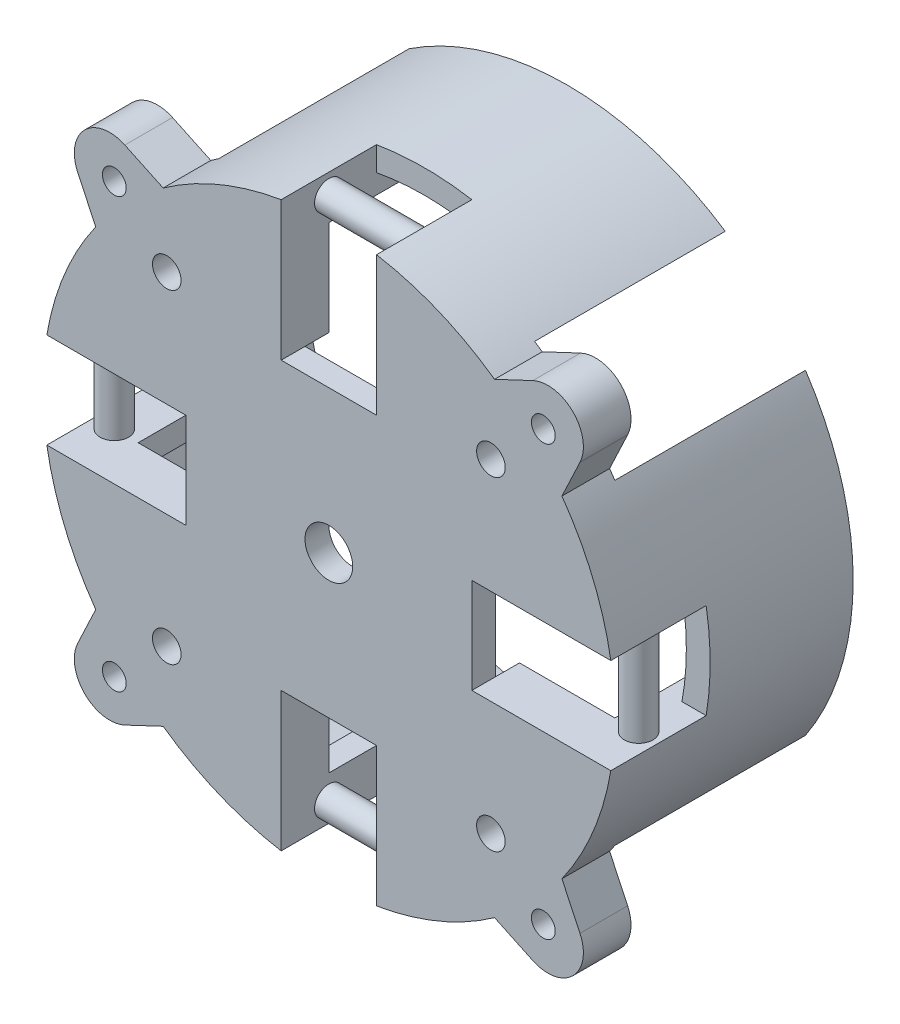
from build123d import *

# Parameters (mm, degrees)
SKETCH_1_R          = 60
EXTRUDE_1_DEPTH     = 50
SKETCH_2_R          = 3
CUT_EXTRUDE_1_DEPTH = 10
SHELL_START         = -50
SHELL_1_DEPTH       = 45
SHELL_1_2_DEPTH     = 35
SKETCH_3_W          = 45
SKETCH_3_H          = 45
SKETCH_3_W_2        = 43.3
SKETCH_3_H_2        = 43.3
EXTRUDE_2_DEPTH     = 25
SKETCH_4_R          = 5
CUT_EXTRUDE_2_DEPTH = 97.046863561
SKETCH_5_W          = 30
SKETCH_5_H          = 20
SKETCH_5_W_2        = 20
SKETCH_5_H_2        = 30
CUT_EXTRUDE_3_DEPTH = 20
SKETCH_6_W          = 24.083269132
SKETCH_6_H          = 5
SKETCH_6_W_2        = 5
SKETCH_6_H_2        = 24.083269132
EXTRUDE_3_DEPTH     = 20
SKETCH_7_R          = 3
EXTRUDE_4_DEPTH     = 20
EXTRUDE_5_REACH     = 106.881
SKETCH_8_R          = 3
SKETCH_10_R         = 2.5
EXTRUDE_6_DEPTH     = 10
SKETCH_11_W         = 100
SKETCH_11_H         = 100
CUT_EXTRUDE_4_DEPTH = 40


# Read off the part's stored shape, not the designer's step: 抽壳1
with BuildPart() as part:
    # 草图1 → 凸台-拉伸1 (new body)
    with BuildSketch(Plane.XY):
        Circle(SKETCH_1_R)
    extrude(amount=-EXTRUDE_1_DEPTH)

    # 草图2 → 切除-拉伸1 (cut)
    with BuildSketch(Plane.XY):
        with Locations((34, 34)):
            Circle(SKETCH_2_R)
        with Locations((34, -34)):
            Circle(SKETCH_2_R)
        with Locations((-34, -34)):
            Circle(SKETCH_2_R)
        with Locations((-34, 34)):
            Circle(SKETCH_2_R)
    extrude(amount=-CUT_EXTRUDE_1_DEPTH, mode=Mode.SUBTRACT)

    # 抽壳1 outline → 抽壳1 (cut)
    with BuildSketch(Plane.XY.offset(SHELL_START)):
        with BuildLine():
            ThreePointArc((41.809731384, -35.734386263), (55, 0), (41.809731384, 35.734386263))
            ThreePointArc((41.809731384, 35.734386263), (28.343145751, 28.343145751), (35.734386263, 41.809731384))
            ThreePointArc((35.734386263, 41.809731384), (0, 55), (-35.734386263, 41.809731384))
            ThreePointArc((-35.734386263, 41.809731384), (-28.343145751, 28.343145751), (-41.809731384, 35.734386263))
            ThreePointArc((-41.809731384, 35.734386263), (-55, 0), (-41.809731384, -35.734386263))
            ThreePointArc((-41.809731384, -35.734386263), (-28.343145751, -28.343145751), (-35.734386263, -41.809731384))
            ThreePointArc((-35.734386263, -41.809731384), (0, -55), (35.734386263, -41.809731384))
            ThreePointArc((35.734386263, -41.809731384), (28.343145751, -28.343145751), (41.809731384, -35.734386263))
        make_face()
    extrude(amount=SHELL_1_DEPTH, mode=Mode.SUBTRACT)

    # Shell 1 2 outline → Shell 1 2 (cut)
    with BuildSketch(Plane.XY.offset(SHELL_START)):
        with BuildLine():
            ThreePointArc((35.734386263, 41.809731384), (28.343145751, 28.343145751), (41.809731384, 35.734386263))
            ThreePointArc((41.809731384, 35.734386263), (38.890872965, 38.890872965), (35.734386263, 41.809731384))
        make_face()
        with BuildLine():
            ThreePointArc((35.734386263, -41.809731384), (38.890872965, -38.890872965), (41.809731384, -35.734386263))
            ThreePointArc((41.809731384, -35.734386263), (28.343145751, -28.343145751), (35.734386263, -41.809731384))
        make_face()
        with BuildLine():
            ThreePointArc((-41.809731384, 35.734386263), (-28.343145751, 28.343145751), (-35.734386263, 41.809731384))
            ThreePointArc((-35.734386263, 41.809731384), (-38.890872965, 38.890872965), (-41.809731384, 35.734386263))
        make_face()
        with BuildLine():
            ThreePointArc((-41.809731384, -35.734386263), (-38.890872965, -38.890872965), (-35.734386263, -41.809731384))
            ThreePointArc((-35.734386263, -41.809731384), (-28.343145751, -28.343145751), (-41.809731384, -35.734386263))
        make_face()
    extrude(amount=SHELL_1_2_DEPTH, mode=Mode.SUBTRACT)

    # 草图3 → 凸台-拉伸2 (add)
    with BuildSketch(Plane.XY):
        Rectangle(SKETCH_3_W, SKETCH_3_H)
        Rectangle(SKETCH_3_W_2, SKETCH_3_H_2, mode=Mode.SUBTRACT)
    extrude(amount=-EXTRUDE_2_DEPTH)

    # 草图4 → 切除-拉伸2 (cut, through all)
    with BuildSketch(Plane(origin=(0, 0, -5), x_dir=(-1, 0, 0), z_dir=(0, 0, -1))):
        Circle(SKETCH_4_R)
    extrude(amount=-CUT_EXTRUDE_2_DEPTH, mode=Mode.SUBTRACT)

    # 草图5 → 切除-拉伸3 (cut)
    with BuildSketch(Plane.XY):
        with Locations((-45, 0)):
            Rectangle(SKETCH_5_W, SKETCH_5_H)
        with Locations((0, 45)):
            Rectangle(SKETCH_5_W_2, SKETCH_5_H_2)
        with Locations((45, 0)):
            Rectangle(SKETCH_5_W, SKETCH_5_H)
        with Locations((0, -45)):
            Rectangle(SKETCH_5_W_2, SKETCH_5_H_2)
    extrude(amount=-CUT_EXTRUDE_3_DEPTH, mode=Mode.SUBTRACT)

    # 草图6 → 凸台-拉伸3 (add)
    with BuildSketch(Plane(origin=(0, 0, -5), x_dir=(-1, 0, 0), z_dir=(0, 0, -1))):
        with Locations((-42.041634566, 12.5)):
            Rectangle(SKETCH_6_W, SKETCH_6_H)
        with Locations((-42.041634566, -12.5)):
            Rectangle(SKETCH_6_W, SKETCH_6_H)
        with Locations((12.5, 42.041634566)):
            Rectangle(SKETCH_6_W_2, SKETCH_6_H_2)
        with Locations((-12.5, 42.041634566)):
            Rectangle(SKETCH_6_W_2, SKETCH_6_H_2)
        with Locations((42.041634566, -12.5)):
            Rectangle(SKETCH_6_W, SKETCH_6_H)
        with Locations((42.041634566, 12.5)):
            Rectangle(SKETCH_6_W, SKETCH_6_H)
        with Locations((-12.5, -42.041634566)):
            Rectangle(SKETCH_6_W_2, SKETCH_6_H_2)
        with Locations((12.5, -42.041634566)):
            Rectangle(SKETCH_6_W_2, SKETCH_6_H_2)
    extrude(amount=EXTRUDE_3_DEPTH)

    # 草图7 → 凸台-拉伸4 (add)
    with BuildSketch(Plane.ZY.offset(-10)):
        with Locations(Location((-10, 55, 0), (0, 0, 180))):
            Circle(SKETCH_7_R)
        with Locations(Location((-10, -55, 0), (0, 0, 90))):
            Circle(SKETCH_7_R)
    extrude(amount=EXTRUDE_4_DEPTH)

    # 草图8 → 凸台-拉伸5 (add, up to next)
    with BuildSketch(Plane.XZ.offset(-10), mode=Mode.PRIVATE) as extrude_5_sk1:
        with Locations(Location((55, -10, 0), (0, 0, 180))):
            Circle(SKETCH_8_R)
    extrude_5_tool1 = extrude(extrude_5_sk1.sketch, amount=EXTRUDE_5_REACH, mode=Mode.PRIVATE) - part.part
    # 草图8 → 凸台-拉伸5 (add, up to next)
    with BuildSketch(Plane.XZ.offset(-10), mode=Mode.PRIVATE) as extrude_5_sk2:
        with Locations(Location((-55, -10, 0), (0, 0, 90))):
            Circle(SKETCH_8_R)
    extrude_5_tool2 = extrude(extrude_5_sk2.sketch, amount=EXTRUDE_5_REACH, mode=Mode.PRIVATE) - part.part
    add(extrude_5_tool1.solids().sort_by_distance((55, 10, -10))[0])
    add(extrude_5_tool2.solids().sort_by_distance((-55, 10, -10))[0])

    # 草图10 → 凸台-拉伸6 (add)
    # profile 1 of 4: a face of its own
    with BuildSketch(Plane.XY):
        with BuildLine():
            Line((-48.904069139, 34.761933515), (-52.68935793, 42.789862994))
            ThreePointArc((-52.68935793, 42.789862994), (-51.221228705, 51.221228705), (-42.789862994, 52.68935793))
            Line((-42.789862994, 52.68935793), (-34.761933515, 48.904069139))
            ThreePointArc((-34.761933515, 48.904069139), (-42.426406871, 42.426406871), (-48.904069139, 34.761933515))
        make_face()
        with Locations((-45, 45)):
            Circle(SKETCH_10_R, mode=Mode.SUBTRACT)
    # profile 2 of 4: a face of its own
    with BuildSketch(Plane.XY):
        with BuildLine():
            Line((34.761933515, 48.904069139), (42.789862994, 52.68935793))
            ThreePointArc((42.789862994, 52.68935793), (51.221228705, 51.221228705), (52.68935793, 42.789862994))
            Line((52.68935793, 42.789862994), (48.904069139, 34.761933515))
            ThreePointArc((48.904069139, 34.761933515), (42.426406871, 42.426406871), (34.761933515, 48.904069139))
        make_face()
        with Locations(Location((45, 45, 0), (0, 0, 180))):
            Circle(SKETCH_10_R, mode=Mode.SUBTRACT)
    # profile 3 of 4: a face of its own
    with BuildSketch(Plane.XY):
        with BuildLine():
            Line((48.904069139, -34.761933515), (52.68935793, -42.789862994))
            ThreePointArc((52.68935793, -42.789862994), (51.221228705, -51.221228705), (42.789862994, -52.68935793))
            Line((42.789862994, -52.68935793), (34.761933515, -48.904069139))
            ThreePointArc((34.761933515, -48.904069139), (42.426406871, -42.426406871), (48.904069139, -34.761933515))
        make_face()
        with Locations((45, -45)):
            Circle(SKETCH_10_R, mode=Mode.SUBTRACT)
    # profile 4 of 4: a face of its own
    with BuildSketch(Plane.XY):
        with BuildLine():
            Line((-34.761933515, -48.904069139), (-42.789862994, -52.68935793))
            ThreePointArc((-42.789862994, -52.68935793), (-51.221228705, -51.221228705), (-52.68935793, -42.789862994))
            Line((-52.68935793, -42.789862994), (-48.904069139, -34.761933515))
            ThreePointArc((-48.904069139, -34.761933515), (-42.426406871, -42.426406871), (-34.761933515, -48.904069139))
        make_face()
        with Locations(Location((-45, -45, 0), (0, 0, 180))):
            Circle(SKETCH_10_R, mode=Mode.SUBTRACT)
    extrude(amount=-EXTRUDE_6_DEPTH)

    # 草图11 → 切除-拉伸4 (cut)
    with BuildSketch(Plane(origin=(0, 0, -50), x_dir=(-1, 0, 0), z_dir=(0, 0, -1))):
        Rectangle(SKETCH_11_W, SKETCH_11_H)
    extrude(amount=-CUT_EXTRUDE_4_DEPTH, mode=Mode.SUBTRACT)


solid = part.part
